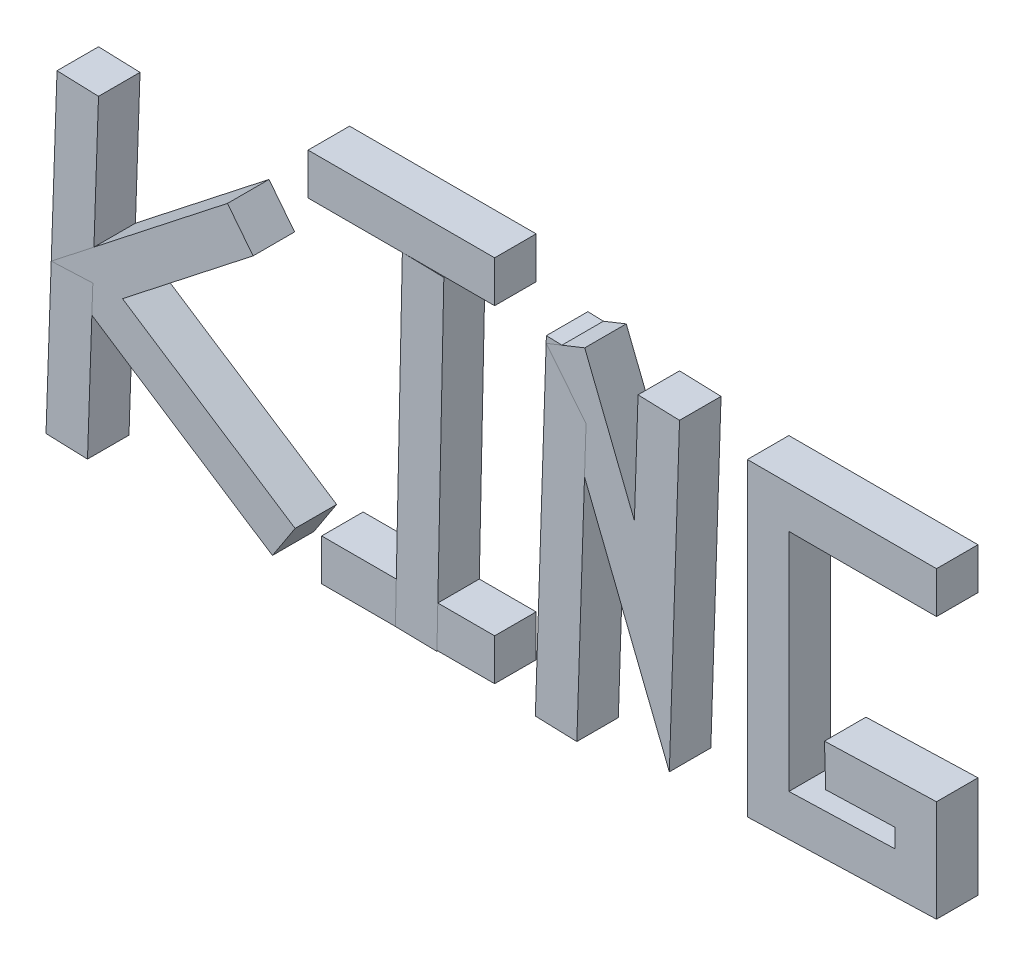
from build123d import *

# Parameters (mm, degrees)
EXTRUDE_THIN16_DEPTH   = 10
EXTRUDE_THIN16_2_DEPTH = 10
SKETCH1_W              = 44.951205154
SKETCH1_H              = 10
EXTRUDE_THIN16_3_DEPTH = 10
EXTRUDE_THIN16_4_DEPTH = 10
SKETCH1_W_2            = 41.682026597
EXTRUDE_THIN16_5_DEPTH = 10
EXTRUDE_THIN16_6_DEPTH = 10
EXTRUDE_THIN16_7_DEPTH = 10
EXTRUDE_THIN16_8_DEPTH = 10


with BuildPart() as part:
    # Sketch1 → Extrude-Thin16 (new body)
    with BuildSketch(Plane.XY):
        Polygon((14.098332526, 85.815937112), (11.442124948, 8.785917371), (21.436184942, 8.441294613), (24.092392519, 85.471314353), align=None)
    extrude(amount=EXTRUDE_THIN16_DEPTH)


with BuildPart() as body_2:
    # Sketch1 → Extrude-Thin16 2 (new body)
    with BuildSketch(Plane.XY):
        Polygon((65.996542112, 10.624830309), (12.704223944, 45.386788253), (55.167388143, 78.664609019), (61.335731843, 70.793679213), (29.866308292, 46.131507745), (71.459892328, 19.000497711), align=None)
    extrude(amount=EXTRUDE_THIN16_2_DEPTH)


with BuildPart() as body_3:
    # Sketch1 → Extrude-Thin16 3 (new body)
    with BuildSketch(Plane.XY):
        with Locations((97.0537384, 94.493762988)):
            Rectangle(SKETCH1_W, SKETCH1_H)
    extrude(amount=EXTRUDE_THIN16_3_DEPTH)


with BuildPart() as body_4:
    # Sketch1 → Extrude-Thin16 4 (new body)
    with BuildSketch(Plane.XY):
        Polygon((97.292656542, 89.493762988), (95.623472782, 10.624830309), (105.621233955, 10.41323748), (107.290417715, 89.282170159), align=None)
    extrude(amount=EXTRUDE_THIN16_4_DEPTH)


with BuildPart() as body_5:
    # Sketch1 → Extrude-Thin16 5 (new body)
    with BuildSketch(Plane.XY):
        with Locations((98.688327679, 15.624830309)):
            Rectangle(SKETCH1_W_2, SKETCH1_H)
    extrude(amount=EXTRUDE_THIN16_5_DEPTH)


with BuildPart() as body_6:
    # Sketch1 → Extrude-Thin16 6 (new body)
    with BuildSketch(Plane.XY):
        Polygon((131.993084224, 89.493762988), (129.336876647, 8.785917371), (139.331465244, 8.456981544), (141.987672821, 89.164827161), align=None)
    extrude(amount=EXTRUDE_THIN16_6_DEPTH)


with BuildPart() as body_7:
    # Sketch1 → Extrude-Thin16 7 (new body)
    with BuildSketch(Plane.XY):
        Polygon((131.939287615, 87.85917371), (161.620014894, 13.281037886), (164.074485187, 87.85917371), (154.07989659, 88.188109537), (153.200870176, 61.479230034), (141.230507075, 91.556908278), align=None)
    extrude(amount=EXTRUDE_THIN16_7_DEPTH)


with BuildPart() as body_8:
    # Sketch1 → Extrude-Thin16 8 (new body)
    with BuildSketch(Plane.XY):
        Polygon((225.981967728, 87.85917371), (180.417791594, 87.85917371), (180.417791594, 13.281037886), (225.981967728, 14.711303505), (225.981967728, 39.23014268), (198.986534353, 38.382752394), (199.300281163, 28.387675459), (215.981967728, 28.911315845), (215.981967728, 24.402327649), (190.417791594, 23.599864721), (190.417791594, 77.85917371), (225.981967728, 77.85917371), align=None)
    extrude(amount=EXTRUDE_THIN16_8_DEPTH)


solid = Compound([part.part, body_2.part, body_3.part, body_4.part, body_5.part, body_6.part, body_7.part, body_8.part])
